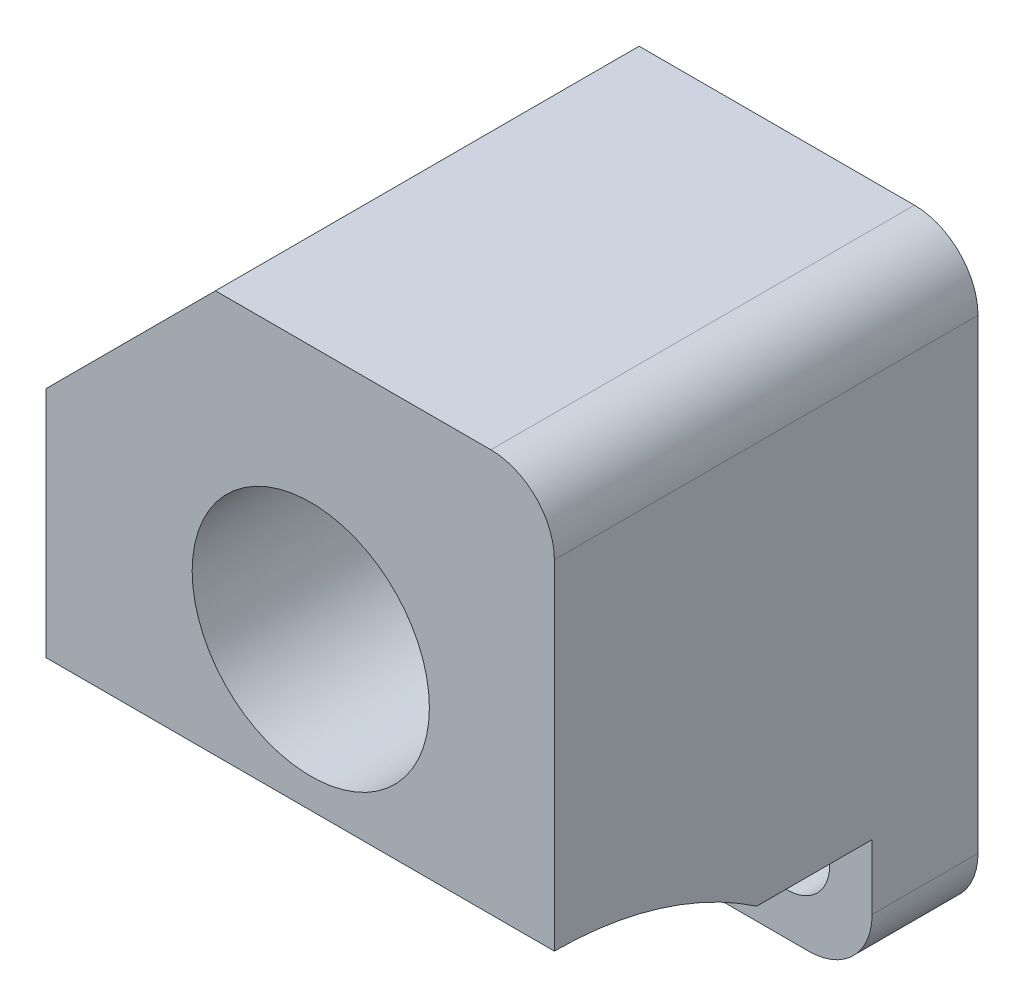
from build123d import *
from build123d.topology import SkipClean

# Parameters (mm, degrees)
SKETCH1_R                   = 2
SKETCH1_R_2                 = 5.6
BOSS_EXTRUDE1_DEPTH         = 20
CUT_EXTRUDE1_DEPTH          = 30
CUT_EXTRUDE2_DEPTH          = 15
FILLET1_R                   = 3
BODY_MOVE_COPY1_OUTLINE_R   = 2
BODY_MOVE_COPY1_DEPTH       = 5
BODY_MOVE_COPY1_2_OUTLINE_R = 2
BODY_MOVE_COPY1_2_DEPTH     = 5
BODY_MOVE_COPY1_3_OUTLINE_R = 5.6
BODY_MOVE_COPY1_3_DEPTH     = 20
BODY_MOVE_COPY1_4_OUTLINE_R = 2
BODY_MOVE_COPY1_4_DEPTH     = 5
BODY_MOVE_COPY1_5_DEPTH     = 24
BODY_MOVE_COPY1_START       = -24
BODY_MOVE_COPY1_6_DEPTH     = 24


with BuildPart() as part:
    # Sketch1 → Boss-Extrude1 (new body)
    with BuildSketch(Plane.XY):
        Polygon((24, 20), (16, 28), (0, 28), (0, 0), (24, 0), align=None)
        with Locations((4, 4)):
            Circle(SKETCH1_R, mode=Mode.SUBTRACT)
        with Locations((14, 4)):
            Circle(SKETCH1_R, mode=Mode.SUBTRACT)
        with Locations((11.5, 16)):
            Circle(SKETCH1_R_2, mode=Mode.SUBTRACT)
    extrude(amount=BOSS_EXTRUDE1_DEPTH)

    # Sketch2 → Cut-Extrude1 (cut)
    with BuildSketch(Plane.ZY):
        with BuildLine():
            Line((20, 9), (20, 0))
            Line((20, 0), (5, 0))
            ThreePointArc((5, 0), (11.253572158, 6.577379737), (20, 9))
        make_face()
    extrude(amount=-CUT_EXTRUDE1_DEPTH, mode=Mode.SUBTRACT)

    # Sketch3 → Cut-Extrude2 (cut)
    with BuildSketch(Plane.XY.offset(20)):
        with BuildLine():
            ThreePointArc((14, -0.5), (17.181980515, 0.818019485), (18.5, 4))
            Line((18.5, 4), (9.5, 4))
            ThreePointArc((9.5, 4), (10.818019485, 0.818019485), (14, -0.5))
        make_face()
        with BuildLine():
            Line((9.5, 4), (18.5, 4))
            ThreePointArc((18.5, 4), (14, 8.5), (9.5, 4))
        make_face()
        with BuildLine():
            ThreePointArc((14, -0.5), (10.818019485, 0.818019485), (9.5, 4))
            Line((9.5, 4), (9.5, -0.5))
            Line((9.5, -0.5), (14, -0.5))
        make_face()
        with BuildLine():
            Line((18.5, -0.5), (18.5, 4))
            ThreePointArc((18.5, 4), (17.181980515, 0.818019485), (14, -0.5))
            Line((14, -0.5), (18.5, -0.5))
        make_face()
        with BuildLine():
            ThreePointArc((4, -0.5), (7.181980515, 0.818019485), (8.5, 4))
            Line((8.5, 4), (0, 4))
            Line((0, 4), (0, 1.938447187))
            ThreePointArc((0, 1.938447187), (1.657670781, 0.157670781), (4, -0.5))
        make_face()
        with BuildLine():
            Line((0, 4), (8.5, 4))
            ThreePointArc((8.5, 4), (2.939339828, 8.373213921), (0, 1.938447187))
            Line((0, 1.938447187), (0, 4))
        make_face()
        with BuildLine():
            Line((8.5, -0.5), (8.5, 4))
            ThreePointArc((8.5, 4), (7.181980515, 0.818019485), (4, -0.5))
            Line((4, -0.5), (8.5, -0.5))
        make_face()
        with BuildLine():
            ThreePointArc((4, -0.5), (1.657670781, 0.157670781), (0, 1.938447187))
            Line((0, 1.938447187), (0, -0.5))
            Line((0, -0.5), (4, -0.5))
        make_face()
    extrude(amount=-CUT_EXTRUDE2_DEPTH, mode=Mode.SUBTRACT)

    # Fillet1
    fillet1_edges = [part.edges().sort_by_distance(p)[0] for p in [
        (0, 28, 10),
        (0, 0, 2.5),
        (24, 0, 2.5),
    ]]
    fillet(fillet1_edges, radius=FILLET1_R)

    # Body-Move/Copy1: read off the stored shape, not the designer's step
    # Body-Move/Copy1 outline → Body-Move/Copy1 (cut)
    with SkipClean():  # the faces are left unmerged after this step: merging them gives an invalid solid
        with BuildSketch(Plane.XY):
            with BuildLine():
                Line((9.5, 4), (9.5, 0))
                Line((9.5, 0), (18.5, 0))
                Line((18.5, 0), (18.5, 4))
                ThreePointArc((18.5, 4), (14, 8.5), (9.5, 4))
            make_face()
            with Locations((14, 4)):
                Circle(BODY_MOVE_COPY1_OUTLINE_R, mode=Mode.SUBTRACT)
        extrude(amount=BODY_MOVE_COPY1_DEPTH, mode=Mode.SUBTRACT)



with BuildPart() as body_2:
    # Body-Move_Copy1 2 outline → Body-Move_Copy1 2 (new body)
    with BuildSketch(Plane.XY):
        with BuildLine():
            Line((-18.5, 0), (-9.5, 0))
            Line((-9.5, 0), (-9.5, 4))
            ThreePointArc((-9.5, 4), (-14, 8.5), (-18.5, 4))
            Line((-18.5, 4), (-18.5, 0))
        make_face()
        with Locations((-14, 4)):
            Circle(BODY_MOVE_COPY1_2_OUTLINE_R, mode=Mode.SUBTRACT)
    extrude(amount=BODY_MOVE_COPY1_2_DEPTH)


with BuildPart() as part_1:
    with SkipClean():  # the faces are left unmerged after this step: merging them gives an invalid solid
        add(part.part)

        add(body_2.part)  # Body-Move_Copy1 3 merges body 2
        # Body-Move_Copy1 3 outline → Body-Move_Copy1 3 (add)
        with BuildSketch(Plane.XY):
            with BuildLine():
                Line((-9.5, 0), (-8.5, 0))
                Line((-8.5, 0), (-8.5, 4))
                ThreePointArc((-8.5, 4), (-5.060660172, 8.373213921), (0, 6.061552813))
                ThreePointArc((0, 6.061552813), (5.060660172, 8.373213921), (8.5, 4))
                Line((8.5, 4), (8.5, 0))
                Line((8.5, 0), (9.5, 0))
                Line((9.5, 0), (9.5, 4))
                ThreePointArc((9.5, 4), (14, 8.5), (18.5, 4))
                Line((18.5, 4), (18.5, 0))
                Line((18.5, 0), (21, 0))
                ThreePointArc((21, 0), (23.121320344, 0.878679656), (24, 3))
                Line((24, 3), (24, 20))
                Line((24, 20), (16, 28))
                Line((16, 28), (3, 28))
                ThreePointArc((3, 28), (0.878679656, 27.121320344), (0, 25))
                ThreePointArc((0, 25), (-0.878679656, 27.121320344), (-3, 28))
                Line((-3, 28), (-16, 28))
                Line((-16, 28), (-24, 20))
                Line((-24, 20), (-24, 3))
                ThreePointArc((-24, 3), (-23.121320344, 0.878679656), (-21, 0))
                Line((-21, 0), (-18.5, 0))
                Line((-18.5, 0), (-18.5, 4))
                ThreePointArc((-18.5, 4), (-14, 8.5), (-9.5, 4))
                Line((-9.5, 4), (-9.5, 0))
            make_face()
            with Locations((-11.5, 16)):
                Circle(BODY_MOVE_COPY1_3_OUTLINE_R, mode=Mode.SUBTRACT)
            with Locations((11.5, 16)):
                Circle(BODY_MOVE_COPY1_3_OUTLINE_R, mode=Mode.SUBTRACT)
        extrude(amount=BODY_MOVE_COPY1_3_DEPTH)

    # Body-Move_Copy1 4 outline → Body-Move_Copy1 4 (add)
    with SkipClean():  # the faces are left unmerged after this step: merging them gives an invalid solid
        with BuildSketch(Plane.XY):
            with BuildLine():
                Line((-8.5, 0), (-3, 0))
                ThreePointArc((-3, 0), (-0.878679656, 0.878679656), (0, 3))
                ThreePointArc((0, 3), (0.878679656, 0.878679656), (3, 0))
                Line((3, 0), (8.5, 0))
                Line((8.5, 0), (8.5, 4))
                ThreePointArc((8.5, 4), (5.060660172, 8.373213921), (0, 6.061552813))
                ThreePointArc((0, 6.061552813), (-5.060660172, 8.373213921), (-8.5, 4))
                Line((-8.5, 4), (-8.5, 0))
            make_face()
            with Locations((-4, 4)):
                Circle(BODY_MOVE_COPY1_4_OUTLINE_R, mode=Mode.SUBTRACT)
            with Locations((4, 4)):
                Circle(BODY_MOVE_COPY1_4_OUTLINE_R, mode=Mode.SUBTRACT)
        extrude(amount=BODY_MOVE_COPY1_4_DEPTH)

    # Body-Move_Copy1 5 outline → Body-Move_Copy1 5 (cut)
    with BuildSketch(Plane.YZ):
        Polygon((0, 20), (0, 4.999999058), (0, 0), (28, 0), (28, 20), align=None)
    extrude(amount=BODY_MOVE_COPY1_5_DEPTH, mode=Mode.SUBTRACT)

    # Body-Move_Copy1 6 outline → Body-Move_Copy1 6 (cut)
    with BuildSketch(Plane.YZ.offset(BODY_MOVE_COPY1_START)):
        with BuildLine():
            Line((0, 20), (-3.531e-06, 4.999998117))
            ThreePointArc((-3.531e-06, 4.999998117), (6.577378708, 11.253570442), (9, 20))
            Line((9, 20), (0, 20))
        make_face()
    extrude(amount=BODY_MOVE_COPY1_6_DEPTH, mode=Mode.SUBTRACT)


solid = part_1.part
